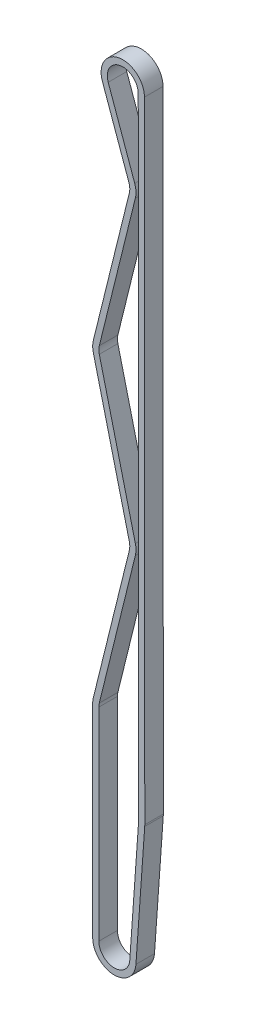
from build123d import *

# Parameters (mm, degrees)
BOSS_EXTRUDE1_DEPTH = 6


with BuildPart() as part:
    # Sketch1 → Boss-Extrude1 (new body)
    with BuildSketch(Plane.XY):
        with BuildLine():
            Line((-3.863813872, 241.196683067), (4.708974243, 217.180940684))
            ThreePointArc((4.708974243, 217.180940684), (4.993688589, 215.751145933), (4.853864442, 214.300000007))
            Line((4.853864442, 214.300000007), (-6.795410149, 167.179999973))
            ThreePointArc((-6.795410149, 167.179999973), (-6.999999929, 165.5), (-6.795410149, 163.820000027))
            Line((-6.795410149, 163.820000027), (4.853864442, 116.699999993))
            ThreePointArc((4.853864442, 116.699999993), (5, 115.5), (4.853864442, 114.300000007))
            Line((4.853864442, 114.300000007), (-6.795410149, 67.179999973))
            ThreePointArc((-6.795410149, 67.179999973), (-6.948664244, 66.34620578), (-6.999999929, 65.5))
            Line((-6.999999929, 65.5), (-6.999999929, 0))
            ThreePointArc((-6.999999929, 0), (-0.247814246, -6.995611989), (6.982453671, -0.495317807))
            Line((6.982453671, -0.495317807), (9.819953671, 39.504682193))
            ThreePointArc((9.819953671, 39.504682193), (9.833177939, 39.754054537), (9.83749893, 40.003739891))
            Line((9.83749893, 40.003739891), (9.728749786, 243.55053427))
            ThreePointArc((9.728749786, 243.55053427), (1.5343234, 250.447343264), (-3.863813872, 241.196683067))
        make_face()
        with BuildLine():
            Line((-5, 0), (-5, 65.5))
            ThreePointArc((-5, 65.5), (-4.963331654, 66.104432706), (-4.853864442, 66.699999993))
            Line((-4.853864442, 66.699999993), (6.795410149, 113.820000027))
            ThreePointArc((6.795410149, 113.820000027), (6.999999929, 115.5), (6.795410149, 117.179999973))
            Line((6.795410149, 117.179999973), (-4.853864442, 164.300000007))
            ThreePointArc((-4.853864442, 164.300000007), (-5, 165.5), (-4.853864442, 166.699999993))
            Line((-4.853864442, 166.699999993), (6.795410149, 213.820000027))
            ThreePointArc((6.795410149, 213.820000027), (6.991163953, 215.851604302), (6.592563872, 217.853316933))
            Line((6.592563872, 217.853316933), (-1.980224243, 241.869059316))
            ThreePointArc((-1.980224243, 241.869059316), (1.875776147, 248.476706365), (7.72875, 243.55))
            Line((7.72875, 243.55), (7.837499286, 40.002671351))
            ThreePointArc((7.837499286, 40.002671351), (7.834412865, 39.824324667), (7.824966959, 39.646201563))
            Line((7.824966959, 39.646201563), (4.987466959, -0.353798437))
            ThreePointArc((4.987466959, -0.353798437), (-0.177010177, -4.996865757), (-5, 0))
        make_face(mode=Mode.SUBTRACT)
    extrude(amount=BOSS_EXTRUDE1_DEPTH)


solid = part.part
